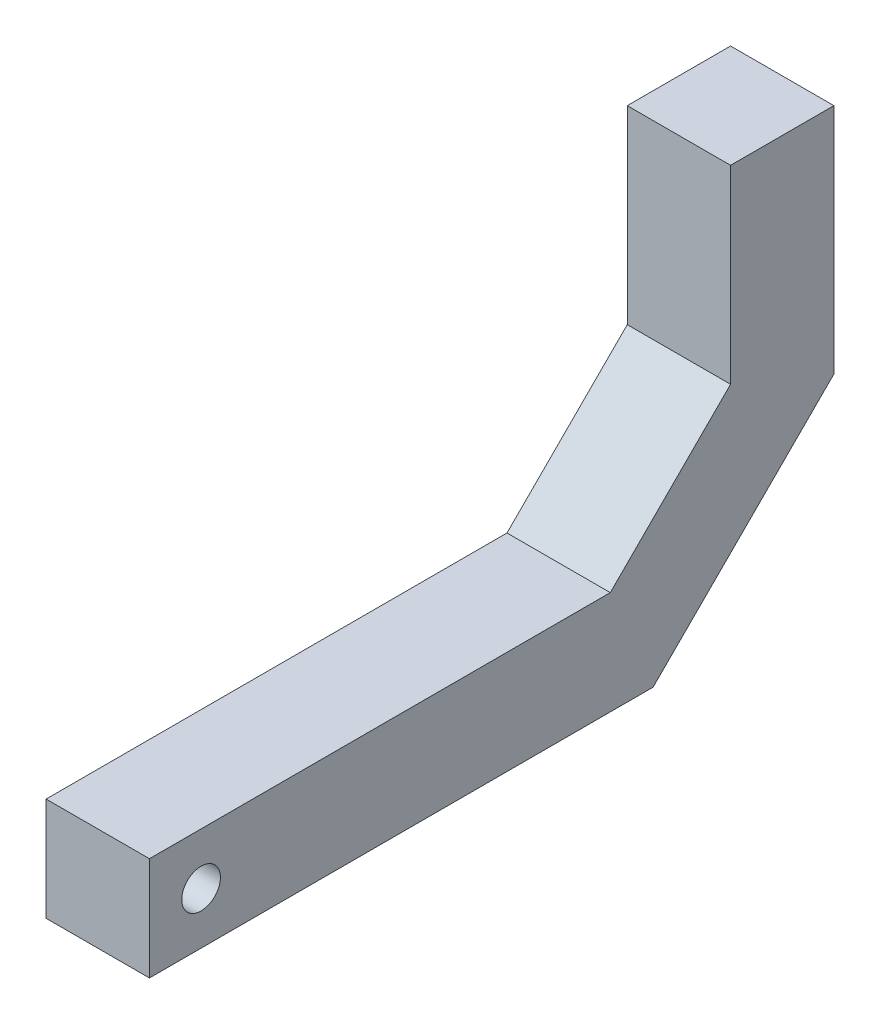
from build123d import *

# Parameters (mm, degrees)
BOSS_EXTRUDE1_DEPTH      = 4
BOSS_EXTRUDE1_DEPTH_BACK = 4
SKETCH1_R                = 1.5


with BuildPart() as part:
    # Sketch1 → Boss-Extrude1 (new, two sides: drawn at the far end of the back side and taken through both)
    with BuildSketch(Plane(origin=(0, 0, 0), x_dir=(0, 0, -1), z_dir=(1, 0, 0)).offset(-BOSS_EXTRUDE1_DEPTH_BACK)):
        Polygon((-8, 4), (0, 4), (0, -14), (-14, -28), (-45, -28), (-53, -28), (-53, -20), (-45, -20), (-17.313708499, -20), (-8, -10.686291501), align=None)
        with Locations((-49, -24)):
            Circle(SKETCH1_R, mode=Mode.SUBTRACT)
    extrude(amount=BOSS_EXTRUDE1_DEPTH + BOSS_EXTRUDE1_DEPTH_BACK)


solid = part.part
